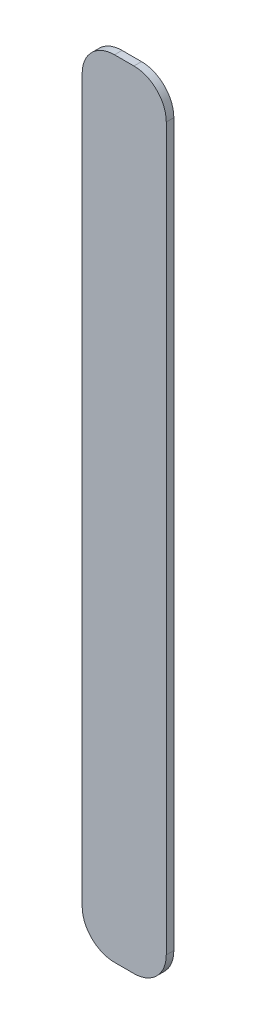
from build123d import *

# Parameters (mm, degrees)
SKETCH1_W          = 13
SKETCH1_H          = 121.5
BASE_FLANGE1_DEPTH = 1.17
FILLET1_R          = 5


# Sheet-metal steps are written as plain solids
with BuildPart() as part:
    # Sketch1 → Base-Flange1 (new body)
    with BuildSketch(Plane.XY):
        with Locations((6.5, 60.75)):
            Rectangle(SKETCH1_W, SKETCH1_H)
    extrude(amount=-BASE_FLANGE1_DEPTH)

    # Fillet1
    fillet1_edges = [part.edges().sort_by_distance(p)[0] for p in [
        (0, 121.5, -0.585),
        (13, 121.5, -0.585),
        (13, 0, -0.585),
        (0, 0, -0.585),
    ]]
    fillet(fillet1_edges, radius=FILLET1_R)


solid = part.part
